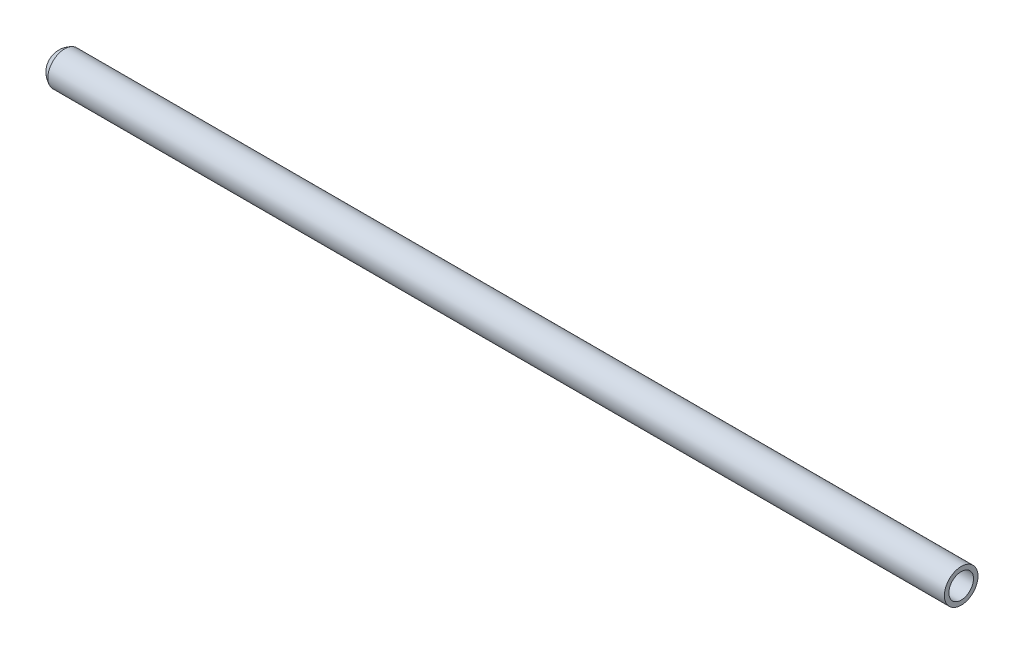
from build123d import *

# Parameters (mm, degrees)
SKETCH1_R           = 9.525
BOSS_EXTRUDE1_DEPTH = 508
DOME1_FACE_RADIUS   = 9.525
DOME1_HEIGHT        = 6.35


# Read off the part's stored shape, not the designer's step: Shell1
with BuildPart() as part:
    # Sketch1 → Boss-Extrude1 (new body)
    with BuildSketch(Plane(origin=(0, 0, 0), x_dir=(0, 0, -1), z_dir=(1, 0, 0))):
        Circle(SKETCH1_R)
    extrude(amount=-BOSS_EXTRUDE1_DEPTH)

    # Dome1: a dome of height H over a round flat face of radius A is a cap of a sphere of radius (A * A + H * H) / (2 * H)
    dome1_r = (DOME1_FACE_RADIUS * DOME1_FACE_RADIUS + DOME1_HEIGHT * DOME1_HEIGHT) / (2 * DOME1_HEIGHT)
    dome1_base = Plane((-508, 0, 0), z_dir=(-1, 0, 0))
    with Locations(dome1_base.offset(DOME1_HEIGHT - dome1_r)):
        dome1_ball = Sphere(dome1_r, mode=Mode.PRIVATE)
    add(split(dome1_ball, bisect_by=dome1_base, keep=Keep.TOP, mode=Mode.PRIVATE))

    # Shell1 outline → Shell1 (revolve, cut)
    with BuildSketch(Plane.YX):
        with BuildLine():
            ThreePointArc((0, -511.81), (4.115838187, -510.631918722), (6.985000003, -507.454512554))
            Line((6.985000003, -507.454512554), (6.985, 0))
            Line((6.985, 0), (0, 0))
            Line((0, 0), (0, -511.81))
        make_face()
    revolve(axis=Axis((0, 0, 0), (1, 0, 0)), mode=Mode.SUBTRACT)


solid = part.part
